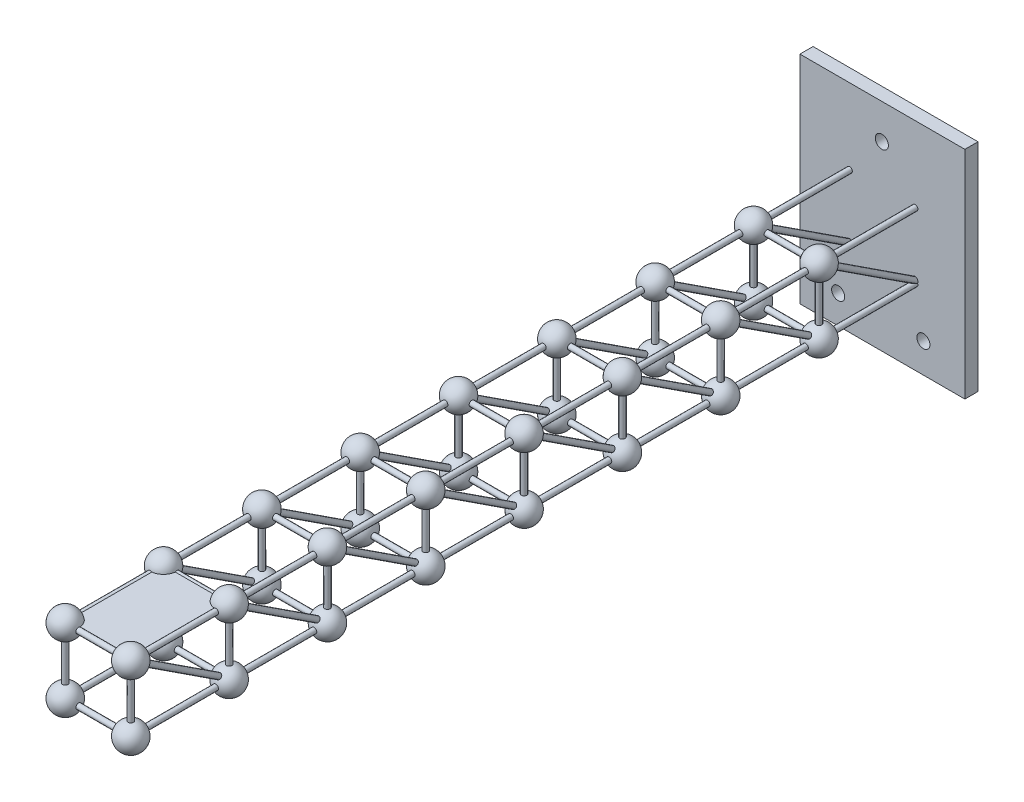
from build123d import *
from build123d.topology import SkipClean

# Parameters (mm, degrees)
SKETCH1_W                = 151
SKETCH1_H                = 198
BOSS_EXTRUDE1_DEPTH      = 12
SKETCH2_R                = 6
CUT_EXTRUDE1_DEPTH       = 12
SKETCH3_R                = 2.5
BOSS_EXTRUDE2_DEPTH      = 100
LPATTERN2_COUNT          = 2
LPATTERN2_PITCH          = 60
LPATTERN2_COUNT_DIR2     = 2
LPATTERN2_PITCH_DIR2     = 60
SKETCH6_R                = 2.5
BOSS_EXTRUDE3_DEPTH      = 60
SKETCH7_R                = 2.5
BOSS_EXTRUDE4_DEPTH      = 60
SKETCH9_R                = 2.500000001
BOSS_EXTRUDE5_DEPTH      = 115
LPATTERN3_COUNT          = 8
LPATTERN3_PITCH          = 90
BOSS_EXTRUDE6_DEPTH      = 2
BOSS_EXTRUDE6_DEPTH_BACK = 2
SKETCH11_W               = 60
SKETCH11_H               = 90


with BuildPart() as part:
    # Sketch1 → Boss-Extrude1 (new body)
    with BuildSketch(Plane.XY):
        with Locations((75.5, -99)):
            Rectangle(SKETCH1_W, SKETCH1_H)
    extrude(amount=BOSS_EXTRUDE1_DEPTH)

    # Sketch2 → Cut-Extrude1 (cut)
    with BuildSketch(Plane.XY.offset(12)):
        with Locations((75, -32)):
            Circle(SKETCH2_R)
        with Locations((35, -172)):
            Circle(SKETCH2_R)
        with Locations((113, -171)):
            Circle(SKETCH2_R)
    extrude(amount=-CUT_EXTRUDE1_DEPTH, mode=Mode.SUBTRACT)

    # Sketch3 → Boss-Extrude2 (add)
    with BuildSketch(Plane.XY):
        with Locations((45.5, -129)):
            Circle(SKETCH3_R)
        with Locations((105.5, -129)):
            Circle(SKETCH3_R)
        with Locations((105.5, -69)):
            Circle(SKETCH3_R)
        with Locations((45.5, -69)):
            Circle(SKETCH3_R)
    boss_extrude2 = extrude(amount=BOSS_EXTRUDE2_DEPTH)

    # Sketch5 → Revolve4 (revolve)
    with BuildSketch(Plane.XY.offset(100)):
        with BuildLine():
            Line((33, -69), (58, -69))
            ThreePointArc((58, -69), (45.5, -56.5), (33, -69))
        make_face()
    revolve4 = revolve(axis=Axis((33, -69, 100), (1, 0, 0)))

    # LPattern2: Revolve4 2 × 2
    with Locations(*[(i * LPATTERN2_PITCH, -j * LPATTERN2_PITCH_DIR2, 0) for i in range(LPATTERN2_COUNT) for j in range(LPATTERN2_COUNT_DIR2) if (i, j) != (0, 0)]):
        add(revolve4)

    # Sketch6 → Boss-Extrude3 (add)
    with BuildSketch(Plane(origin=(0, -70, 0), x_dir=(-1, 0, 0), z_dir=(0, -1, 0))):
        with Locations((-105.5, -100.002551286)):
            Circle(SKETCH6_R)
        with Locations((-45.5, -100.002551286)):
            Circle(SKETCH6_R)
    boss_extrude3 = extrude(amount=BOSS_EXTRUDE3_DEPTH)

    # Sketch7 → Boss-Extrude4 (add)
    with BuildSketch(Plane(origin=(45.5, 0, 0), x_dir=(0, 0, -1), z_dir=(1, 0, 0))):
        with Locations((-100.002551286, -129)):
            Circle(SKETCH7_R)
        with Locations((-100.002551286, -69)):
            Circle(SKETCH7_R)
    boss_extrude4 = extrude(amount=BOSS_EXTRUDE4_DEPTH)

    # Sketch9 → Boss-Extrude5 (add)
    with BuildSketch(Plane(origin=(0, -69, 100.002551286), x_dir=(-1, 0, 0), z_dir=(0, -0.5469819172692052, -0.837144421339893))):
        with Locations((-45.499999999, 0)):
            Circle(SKETCH9_R)
        with Locations((-105.499999999, 0)):
            Circle(SKETCH9_R)
    boss_extrude5 = extrude(amount=BOSS_EXTRUDE5_DEPTH)

    # LPattern3: Boss-Extrude2, Revolve4, Boss-Extrude3, Boss-Extrude4, Boss-Extrude5 ×8
    with SkipClean():  # the faces are left unmerged after this step: merging them gives an invalid solid
        with Locations(*[(0, 0, i * LPATTERN3_PITCH) for i in range(1, LPATTERN3_COUNT)]):
            add(boss_extrude2)
            add(revolve4)
            add(boss_extrude3)
            add(boss_extrude4)
            add(boss_extrude5)

    # LPattern3 copy 1 sketch → LPattern3 copy 1 (revolve)
    with SkipClean():  # the faces are left unmerged after this step: merging them gives an invalid solid
        with BuildSketch(Plane(origin=(0, -60, 190), x_dir=(1, 0, 0), z_dir=(0, 0, 1))):
            with BuildLine():
                Line((33, -69), (58, -69))
                ThreePointArc((58, -69), (45.5, -56.5), (33, -69))
            make_face()
        revolve(axis=Axis((33, -129, 190), (1, 0, 0)))

    # LPattern3 copy 2 sketch → LPattern3 copy 2 (revolve)
    with SkipClean():  # the faces are left unmerged after this step: merging them gives an invalid solid
        with BuildSketch(Plane(origin=(0, -60, 280), x_dir=(1, 0, 0), z_dir=(0, 0, 1))):
            with BuildLine():
                Line((33, -69), (58, -69))
                ThreePointArc((58, -69), (45.5, -56.5), (33, -69))
            make_face()
        revolve(axis=Axis((33, -129, 280), (1, 0, 0)))

    # LPattern3 copy 3 sketch → LPattern3 copy 3 (revolve)
    with SkipClean():  # the faces are left unmerged after this step: merging them gives an invalid solid
        with BuildSketch(Plane(origin=(0, -60, 370), x_dir=(1, 0, 0), z_dir=(0, 0, 1))):
            with BuildLine():
                Line((33, -69), (58, -69))
                ThreePointArc((58, -69), (45.5, -56.5), (33, -69))
            make_face()
        revolve(axis=Axis((33, -129, 370), (1, 0, 0)))

    # LPattern3 copy 4 sketch → LPattern3 copy 4 (revolve)
    with SkipClean():  # the faces are left unmerged after this step: merging them gives an invalid solid
        with BuildSketch(Plane(origin=(0, -60, 460), x_dir=(1, 0, 0), z_dir=(0, 0, 1))):
            with BuildLine():
                Line((33, -69), (58, -69))
                ThreePointArc((58, -69), (45.5, -56.5), (33, -69))
            make_face()
        revolve(axis=Axis((33, -129, 460), (1, 0, 0)))

    # LPattern3 copy 5 sketch → LPattern3 copy 5 (revolve)
    with SkipClean():  # the faces are left unmerged after this step: merging them gives an invalid solid
        with BuildSketch(Plane(origin=(0, -60, 550), x_dir=(1, 0, 0), z_dir=(0, 0, 1))):
            with BuildLine():
                Line((33, -69), (58, -69))
                ThreePointArc((58, -69), (45.5, -56.5), (33, -69))
            make_face()
        revolve(axis=Axis((33, -129, 550), (1, 0, 0)))

    # LPattern3 copy 6 sketch → LPattern3 copy 6 (revolve)
    with SkipClean():  # the faces are left unmerged after this step: merging them gives an invalid solid
        with BuildSketch(Plane(origin=(0, -60, 640), x_dir=(1, 0, 0), z_dir=(0, 0, 1))):
            with BuildLine():
                Line((33, -69), (58, -69))
                ThreePointArc((58, -69), (45.5, -56.5), (33, -69))
            make_face()
        revolve(axis=Axis((33, -129, 640), (1, 0, 0)))

    # LPattern3 copy 7 sketch → LPattern3 copy 7 (revolve)
    with SkipClean():  # the faces are left unmerged after this step: merging them gives an invalid solid
        with BuildSketch(Plane(origin=(0, -60, 730), x_dir=(1, 0, 0), z_dir=(0, 0, 1))):
            with BuildLine():
                Line((33, -69), (58, -69))
                ThreePointArc((58, -69), (45.5, -56.5), (33, -69))
            make_face()
        revolve(axis=Axis((33, -129, 730), (1, 0, 0)))

    # LPattern3 copy 8 sketch → LPattern3 copy 8 (revolve)
    with SkipClean():  # the faces are left unmerged after this step: merging them gives an invalid solid
        with BuildSketch(Plane(origin=(60, 0, 190), x_dir=(1, 0, 0), z_dir=(0, 0, 1))):
            with BuildLine():
                Line((33, -69), (58, -69))
                ThreePointArc((58, -69), (45.5, -56.5), (33, -69))
            make_face()
        revolve(axis=Axis((93, -69, 190), (1, 0, 0)))

    # LPattern3 copy 9 sketch → LPattern3 copy 9 (revolve)
    with SkipClean():  # the faces are left unmerged after this step: merging them gives an invalid solid
        with BuildSketch(Plane(origin=(60, 0, 280), x_dir=(1, 0, 0), z_dir=(0, 0, 1))):
            with BuildLine():
                Line((33, -69), (58, -69))
                ThreePointArc((58, -69), (45.5, -56.5), (33, -69))
            make_face()
        revolve(axis=Axis((93, -69, 280), (1, 0, 0)))

    # LPattern3 copy 10 sketch → LPattern3 copy 10 (revolve)
    with SkipClean():  # the faces are left unmerged after this step: merging them gives an invalid solid
        with BuildSketch(Plane(origin=(60, 0, 370), x_dir=(1, 0, 0), z_dir=(0, 0, 1))):
            with BuildLine():
                Line((33, -69), (58, -69))
                ThreePointArc((58, -69), (45.5, -56.5), (33, -69))
            make_face()
        revolve(axis=Axis((93, -69, 370), (1, 0, 0)))

    # LPattern3 copy 11 sketch → LPattern3 copy 11 (revolve)
    with SkipClean():  # the faces are left unmerged after this step: merging them gives an invalid solid
        with BuildSketch(Plane(origin=(60, 0, 460), x_dir=(1, 0, 0), z_dir=(0, 0, 1))):
            with BuildLine():
                Line((33, -69), (58, -69))
                ThreePointArc((58, -69), (45.5, -56.5), (33, -69))
            make_face()
        revolve(axis=Axis((93, -69, 460), (1, 0, 0)))

    # LPattern3 copy 12 sketch → LPattern3 copy 12 (revolve)
    with SkipClean():  # the faces are left unmerged after this step: merging them gives an invalid solid
        with BuildSketch(Plane(origin=(60, 0, 550), x_dir=(1, 0, 0), z_dir=(0, 0, 1))):
            with BuildLine():
                Line((33, -69), (58, -69))
                ThreePointArc((58, -69), (45.5, -56.5), (33, -69))
            make_face()
        revolve(axis=Axis((93, -69, 550), (1, 0, 0)))

    # LPattern3 copy 13 sketch → LPattern3 copy 13 (revolve)
    with SkipClean():  # the faces are left unmerged after this step: merging them gives an invalid solid
        with BuildSketch(Plane(origin=(60, 0, 640), x_dir=(1, 0, 0), z_dir=(0, 0, 1))):
            with BuildLine():
                Line((33, -69), (58, -69))
                ThreePointArc((58, -69), (45.5, -56.5), (33, -69))
            make_face()
        revolve(axis=Axis((93, -69, 640), (1, 0, 0)))

    # LPattern3 copy 14 sketch → LPattern3 copy 14 (revolve)
    with SkipClean():  # the faces are left unmerged after this step: merging them gives an invalid solid
        with BuildSketch(Plane(origin=(60, 0, 730), x_dir=(1, 0, 0), z_dir=(0, 0, 1))):
            with BuildLine():
                Line((33, -69), (58, -69))
                ThreePointArc((58, -69), (45.5, -56.5), (33, -69))
            make_face()
        revolve(axis=Axis((93, -69, 730), (1, 0, 0)))

    # LPattern3 copy 15 sketch → LPattern3 copy 15 (revolve)
    with SkipClean():  # the faces are left unmerged after this step: merging them gives an invalid solid
        with BuildSketch(Plane(origin=(60, -60, 190), x_dir=(1, 0, 0), z_dir=(0, 0, 1))):
            with BuildLine():
                Line((33, -69), (58, -69))
                ThreePointArc((58, -69), (45.5, -56.5), (33, -69))
            make_face()
        revolve(axis=Axis((93, -129, 190), (1, 0, 0)))

    # LPattern3 copy 16 sketch → LPattern3 copy 16 (revolve)
    with SkipClean():  # the faces are left unmerged after this step: merging them gives an invalid solid
        with BuildSketch(Plane(origin=(60, -60, 280), x_dir=(1, 0, 0), z_dir=(0, 0, 1))):
            with BuildLine():
                Line((33, -69), (58, -69))
                ThreePointArc((58, -69), (45.5, -56.5), (33, -69))
            make_face()
        revolve(axis=Axis((93, -129, 280), (1, 0, 0)))

    # LPattern3 copy 17 sketch → LPattern3 copy 17 (revolve)
    with SkipClean():  # the faces are left unmerged after this step: merging them gives an invalid solid
        with BuildSketch(Plane(origin=(60, -60, 370), x_dir=(1, 0, 0), z_dir=(0, 0, 1))):
            with BuildLine():
                Line((33, -69), (58, -69))
                ThreePointArc((58, -69), (45.5, -56.5), (33, -69))
            make_face()
        revolve(axis=Axis((93, -129, 370), (1, 0, 0)))

    # LPattern3 copy 18 sketch → LPattern3 copy 18 (revolve)
    with SkipClean():  # the faces are left unmerged after this step: merging them gives an invalid solid
        with BuildSketch(Plane(origin=(60, -60, 460), x_dir=(1, 0, 0), z_dir=(0, 0, 1))):
            with BuildLine():
                Line((33, -69), (58, -69))
                ThreePointArc((58, -69), (45.5, -56.5), (33, -69))
            make_face()
        revolve(axis=Axis((93, -129, 460), (1, 0, 0)))

    # LPattern3 copy 19 sketch → LPattern3 copy 19 (revolve)
    with SkipClean():  # the faces are left unmerged after this step: merging them gives an invalid solid
        with BuildSketch(Plane(origin=(60, -60, 550), x_dir=(1, 0, 0), z_dir=(0, 0, 1))):
            with BuildLine():
                Line((33, -69), (58, -69))
                ThreePointArc((58, -69), (45.5, -56.5), (33, -69))
            make_face()
        revolve(axis=Axis((93, -129, 550), (1, 0, 0)))

    # LPattern3 copy 20 sketch → LPattern3 copy 20 (revolve)
    with BuildSketch(Plane(origin=(60, -60, 640), x_dir=(1, 0, 0), z_dir=(0, 0, 1))):
        with BuildLine():
            Line((33, -69), (58, -69))
            ThreePointArc((58, -69), (45.5, -56.5), (33, -69))
        make_face()
    revolve(axis=Axis((93, -129, 640), (1, 0, 0)))

    # LPattern3 copy 21 sketch → LPattern3 copy 21 (revolve)
    with BuildSketch(Plane(origin=(60, -60, 730), x_dir=(1, 0, 0), z_dir=(0, 0, 1))):
        with BuildLine():
            Line((33, -69), (58, -69))
            ThreePointArc((58, -69), (45.5, -56.5), (33, -69))
        make_face()
    revolve(axis=Axis((93, -129, 730), (1, 0, 0)))

    # Sketch11 → Boss-Extrude6 (add, two sides: drawn at the far end of the back side and taken through both)
    with BuildSketch(Plane(origin=(0, -69, 0), x_dir=(-1, 0, 0), z_dir=(0, -1, 0)).offset(-BOSS_EXTRUDE6_DEPTH_BACK)):
        with Locations((-75.5, -685.002551286)):
            Rectangle(SKETCH11_W, SKETCH11_H)
    extrude(amount=BOSS_EXTRUDE6_DEPTH + BOSS_EXTRUDE6_DEPTH_BACK)


solid = part.part
